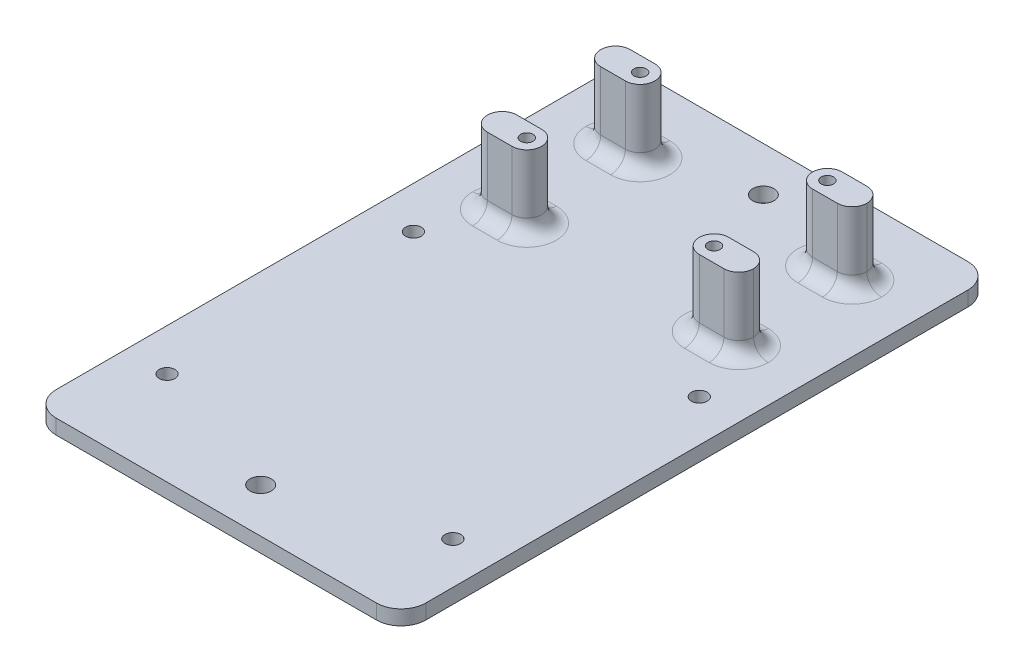
from build123d import *

# Parameters (mm, degrees)
BOSS_EXTRUDE1_DEPTH = 3
SKETCH1_3_R         = 2.15
SKETCH1_3_R_2       = 1.6
SKETCH1_3_R_3       = 1.25
CUT_EXTRUDE1_DEPTH  = 71.818429805
BOSS_EXTRUDE2_START = 15
SKETCH1_4_R         = 1.25
BOSS_EXTRUDE2_DEPTH = 15
FILLET2_R           = 3
FILLET1_R           = 3


with BuildPart() as part:
    # Sketch1 → Boss-Extrude1 (new body)
    with BuildSketch(Plane(origin=(0, 0, 0), x_dir=(1, 0, 0), z_dir=(0, 1, 0))):
        with BuildLine():
            Line((-32.5, 60), (32.5, 60))
            ThreePointArc((32.5, 60), (36.035533906, 58.535533906), (37.5, 55))
            Line((37.5, 55), (37.5, -55))
            ThreePointArc((37.5, -55), (36.035533906, -58.535533906), (32.5, -60))
            Line((32.5, -60), (-32.5, -60))
            ThreePointArc((-32.5, -60), (-36.035533906, -58.535533906), (-37.5, -55))
            Line((-37.5, -55), (-37.5, 55))
            ThreePointArc((-37.5, 55), (-36.035533906, 58.535533906), (-32.5, 60))
        make_face()
    extrude(amount=-BOSS_EXTRUDE1_DEPTH)

    # Sketch1<3> → Cut-Extrude1 (cut, through all)
    with BuildSketch(Plane(origin=(0, 0, 0), x_dir=(1, 0, 0), z_dir=(0, 1, 0))):
        with Locations(Location((0, 51, 0), (0, 0, 270))):
            Circle(SKETCH1_3_R)
        with Locations(Location((0, -51, 0), (0, 0, 270))):
            Circle(SKETCH1_3_R)
        with Locations(Location((-29, -41, 0), (0, 0, 270))):
            Circle(SKETCH1_3_R_2)
        with Locations(Location((29, -41, 0), (0, 0, 270))):
            Circle(SKETCH1_3_R_2)
        with Locations(Location((29, 9, 0), (0, 0, 270))):
            Circle(SKETCH1_3_R_2)
        with Locations(Location((-29, 9, 0), (0, 0, 270))):
            Circle(SKETCH1_3_R_2)
        with Locations(Location((-19, 45, 0), (0, 0, 270))):
            Circle(SKETCH1_3_R_3)
        with Locations(Location((-19, 22, 0), (0, 0, 270))):
            Circle(SKETCH1_3_R_3)
        with Locations(Location((19, 22, 0), (0, 0, 90))):
            Circle(SKETCH1_3_R_3)
        with Locations(Location((19, 45, 0), (0, 0, 90))):
            Circle(SKETCH1_3_R_3)
    extrude(amount=-CUT_EXTRUDE1_DEPTH, mode=Mode.SUBTRACT)

    # Sketch1<4> → Boss-Extrude2 (add)
    # profile 1 of 4: a face of its own
    with BuildSketch(Plane(origin=(0, 0, 0), x_dir=(1, 0, 0), z_dir=(0, 1, 0)).offset(BOSS_EXTRUDE2_START)):
        with BuildLine():
            Line((-27, 42), (-19, 42))
            ThreePointArc((-19, 42), (-16, 45), (-19, 48))
            Line((-19, 48), (-27, 48))
            Line((-27, 48), (-27, 42))
        make_face()
        with Locations(Location((-19, 45, 0), (0, 0, 270))):
            Circle(SKETCH1_4_R, mode=Mode.SUBTRACT)
    # profile 2 of 4: a face of its own
    with BuildSketch(Plane(origin=(0, 0, 0), x_dir=(1, 0, 0), z_dir=(0, 1, 0)).offset(BOSS_EXTRUDE2_START)):
        with BuildLine():
            Line((-27, 19), (-19, 19))
            ThreePointArc((-19, 19), (-16, 22), (-19, 25))
            Line((-19, 25), (-27, 25))
            Line((-27, 25), (-27, 19))
        make_face()
        with Locations(Location((-19, 22, 0), (0, 0, 270))):
            Circle(SKETCH1_4_R, mode=Mode.SUBTRACT)
    # profile 3 of 4: a face of its own
    with BuildSketch(Plane(origin=(0, 0, 0), x_dir=(1, 0, 0), z_dir=(0, 1, 0)).offset(BOSS_EXTRUDE2_START)):
        with BuildLine():
            ThreePointArc((19, 19), (16, 22), (19, 25))
            Line((19, 25), (27, 25))
            Line((27, 25), (27, 19))
            Line((27, 19), (19, 19))
        make_face()
        with Locations(Location((19, 22, 0), (0, 0, 270))):
            Circle(SKETCH1_4_R, mode=Mode.SUBTRACT)
    # profile 4 of 4: a face of its own
    with BuildSketch(Plane(origin=(0, 0, 0), x_dir=(1, 0, 0), z_dir=(0, 1, 0)).offset(BOSS_EXTRUDE2_START)):
        with BuildLine():
            ThreePointArc((19, 42), (16, 45), (19, 48))
            Line((19, 48), (27, 48))
            Line((27, 48), (27, 42))
            Line((27, 42), (19, 42))
        make_face()
        with Locations(Location((19, 45, 0), (0, 0, 270))):
            Circle(SKETCH1_4_R, mode=Mode.SUBTRACT)
    extrude(amount=-BOSS_EXTRUDE2_DEPTH)

    # Fillet2
    fillet2_edges = [part.edges().sort_by_distance(p)[0] for p in [
        (-27, 7.5, -48),
        (-27, 7.5, -42),
        (-27, 7.5, -25),
        (-27, 7.5, -19),
        (27, 7.5, -19),
        (27, 7.5, -25),
        (27, 7.5, -48),
        (27, 7.5, -42),
    ]]
    fillet(fillet2_edges, radius=FILLET2_R - 0.0001)  # a hair under: the kernel refuses the full size

    # Fillet1
    fillet1_edges = [part.edges().sort_by_distance(p)[0] for p in [
        (16, 0, -22),
        (21.50005, 0, -25),
        (16, 0, -45),
        (21.50005, 0, -48),
        (-21.50005, 0, -42),
        (-21.50005, 0, -19),
        (21.50005, 0, -19),
        (21.50005, 0, -42),
        (-26.121349633, 0, -47.121349633),
        (-26.121349633, 0, -42.878650367),
        (-26.121349633, 0, -24.121349633),
        (-26.121349633, 0, -19.878650367),
        (26.121349633, 0, -19.878650367),
        (26.121349633, 0, -24.121349633),
        (26.121349633, 0, -47.121349633),
        (26.121349633, 0, -42.878650367),
        (-16, 0, -45),
        (-21.50005, 0, -48),
        (-16, 0, -22),
        (-21.50005, 0, -25),
    ]]
    fillet(fillet1_edges, radius=FILLET1_R)


solid = part.part
